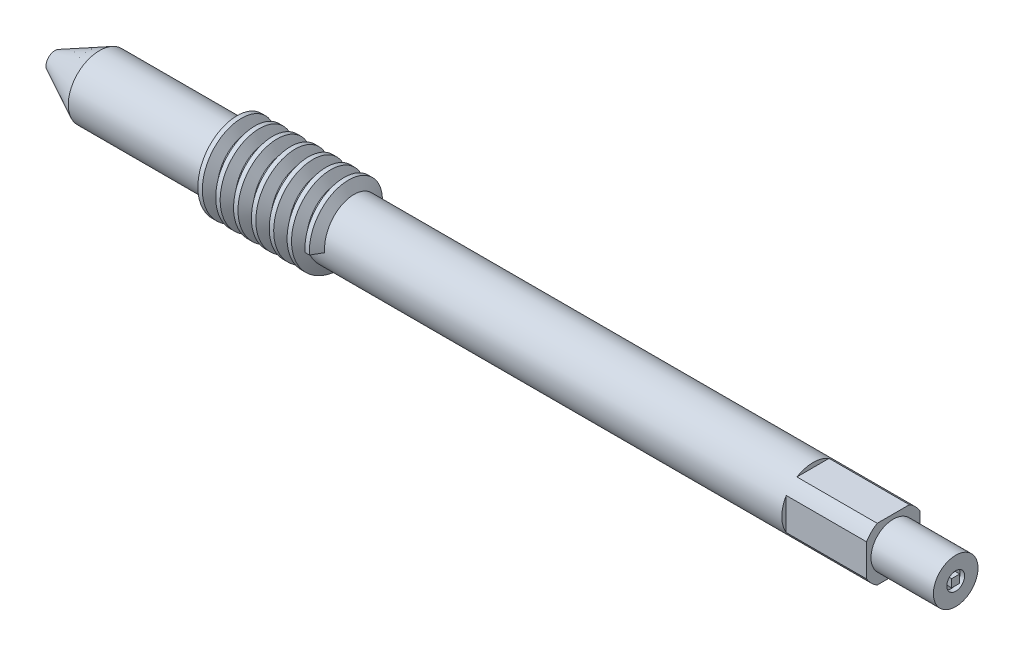
from build123d import *

# Parameters (mm, degrees)
EXTRUDE_START       = 9
EXTRUDE_1_DEPTH     = 9
SKETCH_4_R          = 2.5
EXTRUDE_2_DEPTH     = 7
SKETCH_5_R          = 1
CUT_EXTRUDE_1_DEPTH = 0.5
SKETCH_6_W          = 0.9
SKETCH_6_H          = 0.9
EXTRUDE_3_DEPTH     = 0.5
THREAD_1_PITCH      = 2


with BuildPart() as part:
    # Эскиз2 → Повернуть1 (revolve)
    with BuildSketch(Plane.XY, mode=Mode.PRIVATE) as revolve_1_sk:
        Polygon((0, 0), (0, 1), (5, 3.5), (85, 3.5), (85, 0), align=None)
    revolve(revolve_1_sk.sketch.rotate(Axis((0, 0, 0), (1, 0, 0)), 90), axis=Axis((0, 0, 0), (1, 0, 0)))

    # Эскиз3 → Бобышка-Вытянуть1 (add)
    with BuildSketch(Plane(origin=(85, 0, 0), x_dir=(0, 0, -1), z_dir=(1, 0, 0)).offset(EXTRUDE_START)):
        with BuildLine():
            Line((-1.802775638, -3), (1.802775638, -3))
            ThreePointArc((1.802775638, -3), (2.474873734, -2.474873734), (3, -1.802775638))
            Line((3, -1.802775638), (3, 1.802775638))
            ThreePointArc((3, 1.802775638), (2.474873734, 2.474873734), (1.802775638, 3))
            Line((1.802775638, 3), (-1.802775638, 3))
            ThreePointArc((-1.802775638, 3), (-2.474873734, 2.474873734), (-3, 1.802775638))
            Line((-3, 1.802775638), (-3, -1.802775638))
            ThreePointArc((-3, -1.802775638), (-2.474873734, -2.474873734), (-1.802775638, -3))
        make_face()
    extrude(amount=-EXTRUDE_1_DEPTH)

    # Эскиз4 → Бобышка-Вытянуть2 (add)
    with BuildSketch(Plane(origin=(94, 0, 0), x_dir=(0, 0, -1), z_dir=(1, 0, 0))):
        Circle(SKETCH_4_R)
    extrude(amount=EXTRUDE_2_DEPTH)

    # Эскиз5 → Вырез-Вытянуть1 (cut)
    with BuildSketch(Plane(origin=(101, 0, 0), x_dir=(0, 0, -1), z_dir=(1, 0, 0))):
        Circle(SKETCH_5_R)
    extrude(amount=-CUT_EXTRUDE_1_DEPTH, mode=Mode.SUBTRACT)

    # Эскиз6 → Бобышка-Вытянуть3 (add)
    with BuildSketch(Plane(origin=(100.5, 0, 0), x_dir=(0, 0, -1), z_dir=(1, 0, 0))):
        Rectangle(SKETCH_6_W, SKETCH_6_H)
    extrude(amount=EXTRUDE_3_DEPTH)

    # Резьба1: the profile of Профиль резьбы1 profile screwed along a right-hand helix of 6.5 turns, 10 arcs to a turn; built about Z, then put on its axis
    thread_1_z = Axis((0, 0, 0), (0, 0, 1))
    thread_1_corners = [(3.4997, 0, -0.000173205), (3.4997, 0, 1.7501732), (4.58253175, 0, 1.124999997), (4.58253175, 0, 0.624999997)]
    with BuildLine(mode=Mode.PRIVATE) as thread_1_profile:
        Line(thread_1_corners[0], thread_1_corners[1])
        Line(thread_1_corners[1], thread_1_corners[2])
        Line(thread_1_corners[2], thread_1_corners[3])
        Line(thread_1_corners[3], thread_1_corners[0])
    thread_1_cap = Face(thread_1_profile.wire())
    thread_1_turn_angles = [0, 18, 36, 54, 72, 90, 108, 126, 144, 162, 180, 198, 216, 234, 252, 270, 288, 306, 324, 342, 360]
    thread_1_turn_weights = [1, 0.9510565162951535, 1, 0.9510565162951535, 1, 0.9510565162951535, 1, 0.9510565162951535, 1, 0.9510565162951535, 1, 0.9510565162951535, 1, 0.9510565162951535, 1, 0.9510565162951535, 1, 0.9510565162951535, 1, 0.9510565162951535, 1]
    thread_1_turn_rails = [Edge.make_bspline([Vector(p[0], p[1], 0).rotate(thread_1_z, thread_1_turn_angles[k]) / thread_1_turn_weights[k] + Vector(0, 0, p[2] + THREAD_1_PITCH * thread_1_turn_angles[k] / 360) for k in range(21)], [0, 0, 0, 1, 1, 2, 2, 3, 3, 4, 4, 5, 5, 6, 6, 7, 7, 8, 8, 9, 9, 10, 10, 10], 2, thread_1_turn_weights) for p in thread_1_corners]
    thread_1_turn_sides = [Face.make_surface_from_curves(thread_1_turn_rails[p[0]], thread_1_turn_rails[p[1]]) for p in [(0, 1), (1, 2), (2, 3), (3, 0)]]
    thread_1_last_angles = [2160, 2178, 2196, 2214, 2232, 2250, 2268, 2286, 2304, 2322, 2340]
    thread_1_last_weights = [1, 0.9510565162951535, 1, 0.9510565162951535, 1, 0.9510565162951535, 1, 0.9510565162951535, 1, 0.9510565162951535, 1]
    thread_1_last_rails = [Edge.make_bspline([Vector(p[0], p[1], 0).rotate(thread_1_z, thread_1_last_angles[k]) / thread_1_last_weights[k] + Vector(0, 0, p[2] + THREAD_1_PITCH * thread_1_last_angles[k] / 360) for k in range(11)], [0, 0, 0, 1, 1, 2, 2, 3, 3, 4, 4, 5, 5, 5], 2, thread_1_last_weights) for p in thread_1_corners]
    thread_1_last_sides = [Face.make_surface_from_curves(thread_1_last_rails[p[0]], thread_1_last_rails[p[1]]) for p in [(0, 1), (1, 2), (2, 3), (3, 0)]]
    thread_1 = Plane(origin=(19, 0, 0), x_dir=(0, 0, -1), z_dir=(1, 0, 0)) * Solid(Shell([*[p.moved(Location((0, 0, THREAD_1_PITCH * i))) for i in range(6) for p in thread_1_turn_sides], *thread_1_last_sides, thread_1_cap, thread_1_cap.rotate(thread_1_z, 2340).moved(Location((0, 0, THREAD_1_PITCH * 2340 / 360)))]))
    add(thread_1)


solid = part.part
